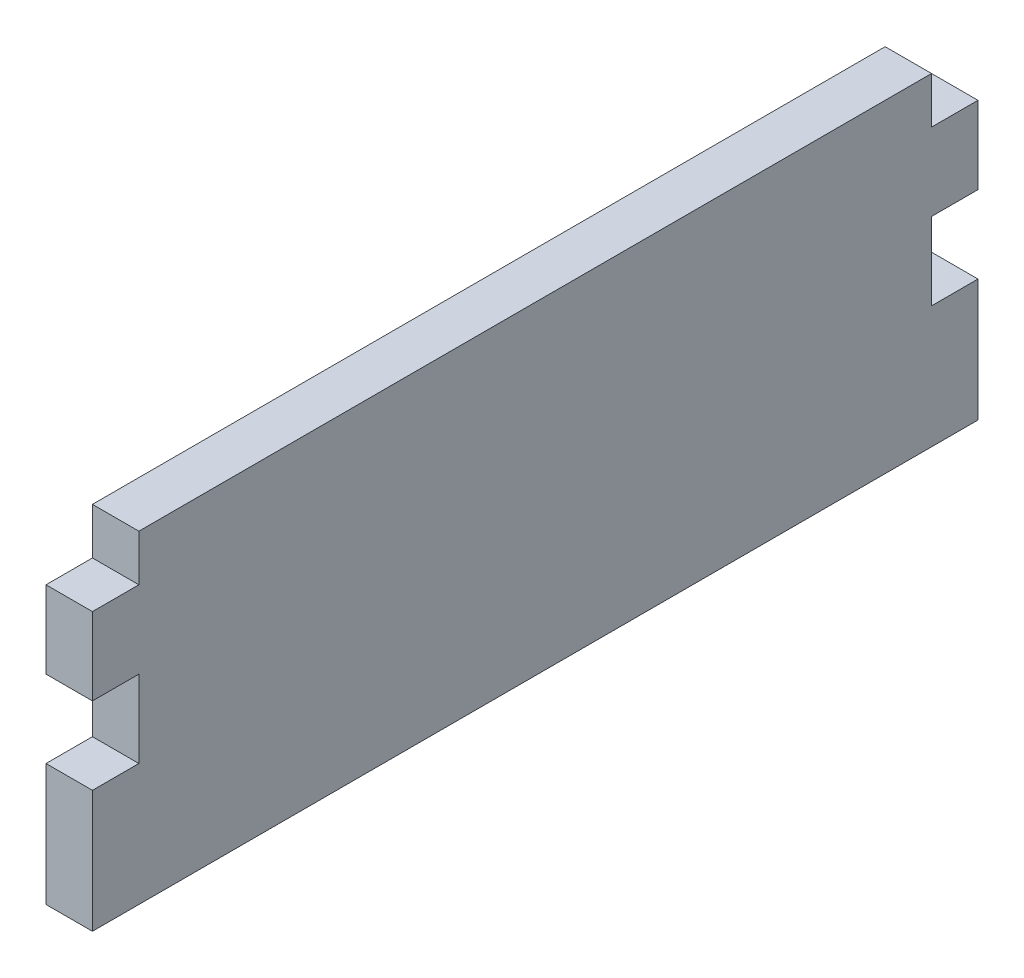
from build123d import *

# Parameters (mm, degrees)
EXTRUDE_1_DEPTH = 6


with BuildPart() as part:
    # Эскиз1 → Бобышка-Вытянуть1 (new body)
    with BuildSketch(Plane(origin=(0, 0, 0), x_dir=(0, 0, -1), z_dir=(1, 0, 0))):
        Polygon((-111.412543362, -137.17155652), (3.017456638, -137.17155652), (3.017456638, -121.39155652), (-2.982543362, -121.39155652), (-2.982543362, -111.39155652), (3.017456638, -111.39155652), (3.017456638, -101.39155652), (-2.982543362, -101.39155652), (-2.982543362, -95.39155652), (-105.412543362, -95.39155652), (-105.412543362, -101.39155652), (-111.412543362, -101.39155652), (-111.412543362, -111.39155652), (-105.412543362, -111.39155652), (-105.412543362, -121.39155652), (-111.412543362, -121.39155652), align=None)
    extrude(amount=EXTRUDE_1_DEPTH)


solid = part.part
